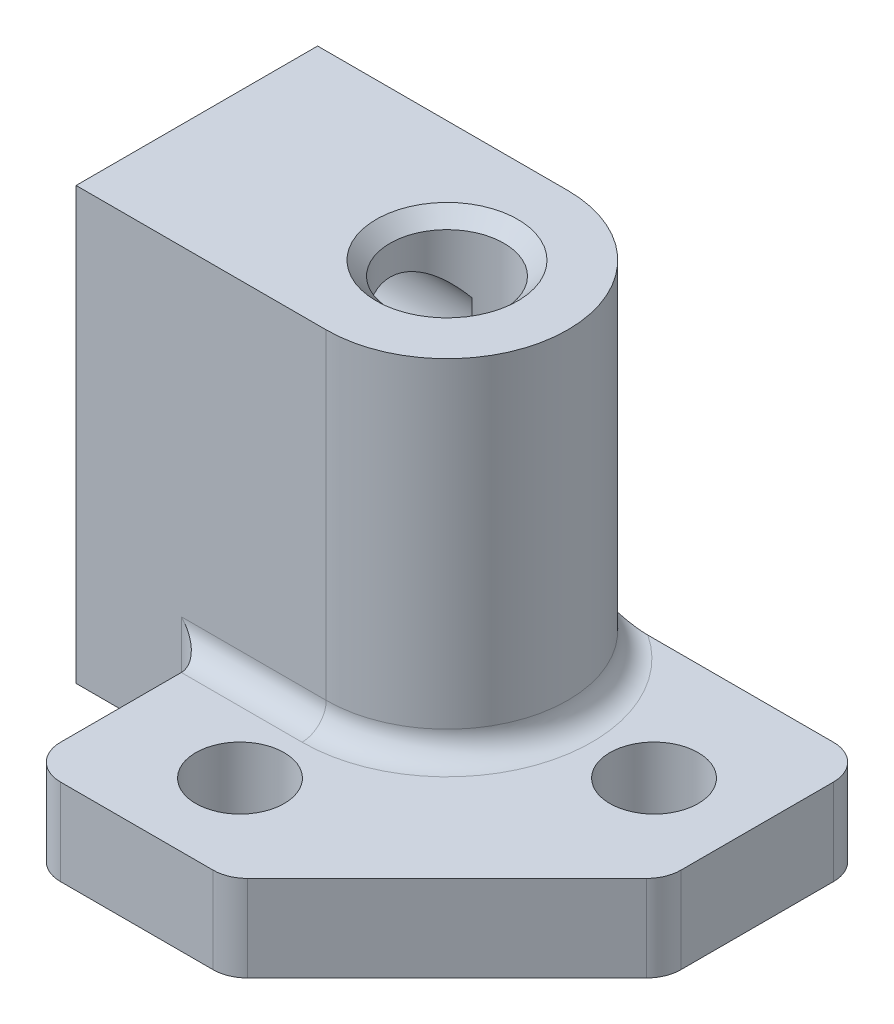
from build123d import *

# Parameters (mm, degrees)
SKETCH1_R           = 4.445
SKETCH1_R_2         = 2.0955
BOSS_EXTRUDE1_DEPTH = 12.7
BOSS_EXTRUDE2_START = 3.175
SKETCH2_R           = 1.6256
BOSS_EXTRUDE2_DEPTH = 3.175
FILLET5_R           = 1.27
BOSS_EXTRUDE3_REACH = 24.275
CHAMFER1_SIZE       = 0.508
SKETCH3_R           = 2.2225
CUT_EXTRUDE1_DEPTH  = 8.255
FILLET6_R           = 0.889


with BuildPart() as part:
    # Sketch1 → Boss-Extrude1 (new body)
    with BuildSketch(Plane(origin=(0, 0, 0), x_dir=(1, 0, 0), z_dir=(0, 1, 0))):
        with Locations(Location((0, 0, 0), (0, 0, 270))):
            Circle(SKETCH1_R)
        with Locations(Location((0, 0, 0), (0, 0, 270))):
            Circle(SKETCH1_R_2, mode=Mode.SUBTRACT)
    extrude(amount=BOSS_EXTRUDE1_DEPTH)

    # Sketch2 → Boss-Extrude2 (add)
    with BuildSketch(Plane.XZ.offset(BOSS_EXTRUDE2_START)):
        with BuildLine():
            Line((-4.445, 0), (-4.445, 11.049))
            Line((-4.445, 11.049), (2.966769491, 11.049))
            Line((2.966769491, 11.049), (11.049, 2.966769491))
            Line((11.049, 2.966769491), (11.049, -4.445))
            Line((11.049, -4.445), (0, -4.445))
            ThreePointArc((0, -4.445), (-3.143089642, -3.143089642), (-4.445, 0))
        make_face()
        with Locations(Location((0, 7.62, 0), (0, 0, 270))):
            Circle(SKETCH2_R, mode=Mode.SUBTRACT)
        with Locations(Location((7.62, 0, 0), (0, 0, 270))):
            Circle(SKETCH2_R, mode=Mode.SUBTRACT)
    extrude(amount=-BOSS_EXTRUDE2_DEPTH)

    # Fillet5
    fillet5_edges = [part.edges().sort_by_distance(p)[0] for p in [
        (11.049, -1.5875, -4.445),
        (11.049, -1.5875, 2.966769491),
        (2.966769491, -1.5875, 11.049),
        (-4.445, -1.5875, 11.049),
    ]]
    fillet(fillet5_edges, radius=FILLET5_R)

    # Boss-Extrude3: up to this face of the body (flat: up to its plane)
    boss_extrude3_end = Plane(part.part.faces().sort_by_distance((2.521124126, -3.175, 2.521124126))[0])
    # Sketch4 → Boss-Extrude3 (add, up to the picked face)
    with BuildSketch(Plane(origin=(0, 12.7, 0), x_dir=(1, 0, 0), z_dir=(0, 1, 0)), mode=Mode.PRIVATE) as boss_extrude3_sk1:
        with BuildLine():
            Line((0, 4.445), (-9.2075, 4.445))
            Line((-9.2075, 4.445), (-9.2075, -4.445))
            Line((-9.2075, -4.445), (0, -4.445))
            ThreePointArc((0, -4.445), (-4.445, 0), (0, 4.445))
        make_face()
    boss_extrude3_tool1 = split(extrude(boss_extrude3_sk1.sketch, amount=-BOSS_EXTRUDE3_REACH, mode=Mode.PRIVATE), bisect_by=boss_extrude3_end, keep=Keep.BOTH, mode=Mode.PRIVATE)
    add(boss_extrude3_tool1.solids().sort_by(Axis((-6.263205, 12.7, 0), (0, -1, 0)))[0])

    # Chamfer1
    chamfer1_edges = [part.edges().sort_by_distance(p)[0] for p in [
        (0, 12.7, -2.0955),
    ]]
    chamfer(chamfer1_edges, length=CHAMFER1_SIZE)

    # Sketch3 → Cut-Extrude1 (cut)
    with BuildSketch(Plane(origin=(-9.2075, 0, 0), x_dir=(0, 0, -1), z_dir=(1, 0, 0))):
        with Locations(Location((0, 8.89, 0), (0, 0, 212.878349564))):
            Circle(SKETCH3_R)
        with Locations(Location((0, 2.54, 0), (0, 0, 212.878349564))):
            Circle(SKETCH3_R)
    extrude(amount=CUT_EXTRUDE1_DEPTH, mode=Mode.SUBTRACT)

    # Fillet6
    # the kernel refuses this fillet: 0.889 mm, written as the material it adds along each edge
    with BuildSketch(Plane(origin=(-4.445, 0, 4.445), x_dir=(-1, 0, 0), z_dir=(0, -1, 0))) as fillet6_piece_1:
        with BuildLine():
            CenterArc((FILLET6_R, -FILLET6_R), FILLET6_R, 90, 90)
            Line((0, -FILLET6_R), (0, 0))
            Line((0, 0), (FILLET6_R, 0))
        make_face()
    extrude(amount=3.175)
    with BuildSketch(Plane(origin=(0, 0, 0), x_dir=(0, 0, 1), z_dir=(-1, 0, 0))) as fillet6_piece_2_section:
        with BuildLine():
            CenterArc((4.445 + FILLET6_R, FILLET6_R), FILLET6_R, 180, 90)
            Line((4.445 + FILLET6_R, 0), (4.445, 0))
            Line((4.445, 0), (4.445, FILLET6_R))
        make_face()
    fillet6_piece_2 = revolve(axis=Axis((0, 0, 0), (0, 1, 0)), revolution_arc=228.779733666, mode=Mode.PRIVATE)
    fillet6_piece_2 = split(fillet6_piece_2, bisect_by=Plane(origin=(0, 0, -4.445), z_dir=(0, 0, 1)), keep=Keep.TOP, mode=Mode.PRIVATE)
    add(fillet6_piece_2)
    with BuildSketch(Plane(origin=(-4.445, 0, 4.445), x_dir=(0, 1, 0), z_dir=(1, 0, 0))) as fillet6_piece_3:
        with BuildLine():
            CenterArc((FILLET6_R, FILLET6_R), FILLET6_R, 180, 90)
            Line((0, FILLET6_R), (0, 0))
            Line((0, 0), (FILLET6_R, 0))
        make_face()
    extrude(amount=4.445)
    with BuildSketch(Plane(origin=(-6.6675, 0, 4.445), x_dir=(0, 1, 0), z_dir=(1, 0, 0))) as fillet6_piece_4a_section:
        with BuildLine():
            CenterArc((FILLET6_R, FILLET6_R), FILLET6_R, 180, 90)
            Line((0, FILLET6_R), (0, 0))
            Line((0, 0), (FILLET6_R, 0))
        make_face()
    fillet6_piece_4a = extrude(amount=6.6675, mode=Mode.PRIVATE)
    fillet6_piece_4a = split(fillet6_piece_4a, bisect_by=Plane(origin=(-4.445, 0, 4.445), z_dir=(-1, 0, 0)), keep=Keep.TOP, mode=Mode.PRIVATE)
    with BuildSketch(Plane(origin=(-4.445, 2.2225, 4.445), x_dir=(-1, 0, 0), z_dir=(0, -1, 0))) as fillet6_piece_4b_section:
        with BuildLine():
            CenterArc((FILLET6_R, -FILLET6_R), FILLET6_R, 90, 90)
            Line((0, -FILLET6_R), (0, 0))
            Line((0, 0), (FILLET6_R, 0))
        make_face()
    fillet6_piece_4b = extrude(amount=5.3975, mode=Mode.PRIVATE)
    fillet6_piece_4b = split(fillet6_piece_4b, bisect_by=Plane(origin=(-4.445, 0, 4.445), z_dir=(0, 1, 0)), keep=Keep.TOP, mode=Mode.PRIVATE)
    fillet6_piece_4 = fillet6_piece_4a & fillet6_piece_4b
    add(fillet6_piece_4)


solid = part.part
